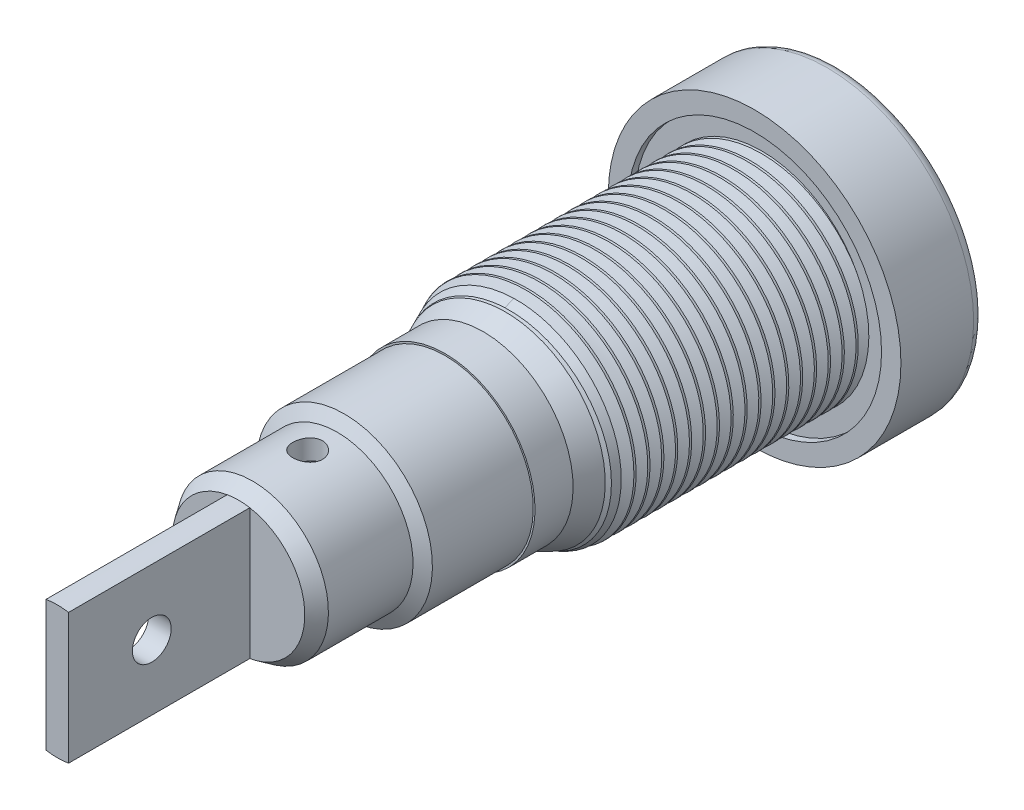
from build123d import *

# Parameters (mm, degrees)
CUT_EXTRUDE1_DEPTH              = 6.5278
CIRPATTERN1_COUNT               = 2
SKETCH3_R                       = 4.572
SKETCH3_R_2                     = 3.8608
CUT_EXTRUDE2_DEPTH              = 0.254
THREAD1_PITCH                   = 0.5
SKETCH6_R                       = 0.6985
CUT_EXTRUDE3_DEPTH              = 2.54
F_58_0_042_DIAMETER_HOLE1_D     = 1.0668
F_58_0_042_DIAMETER_HOLE1_DEPTH = 3.9878
F_58_0_042_DIAMETER_HOLE1_TIP   = 0.320499054
SKETCH8_R                       = 2.4765
CUT_EXTRUDE4_DEPTH              = 3.175
F_21_0_159_DIAMETER_HOLE1_D     = 4.0386
F_21_0_159_DIAMETER_HOLE1_DEPTH = 16.0528
F_21_0_159_DIAMETER_HOLE1_TIP   = 1.213317848
CHAMFER1_SIZE                   = 0.254
FILLET1_R                       = 0.381
CHAMFER2_SIZE                   = 0.254


with BuildPart() as part:
    # Sketch1 → Revolve1 (revolve)
    with BuildSketch(Plane(origin=(0, 0, 0), x_dir=(0, 0, -1), z_dir=(1, 0, 0))):
        Polygon((0, 0), (0, 5.2705), (-2.99974, 5.2705), (-2.99974, 3.8608), (-11.3792, 3.8608), (-12.7762, 3.2385), (-14.1478, 3.2385), (-14.1478, 3.175), (-17.78, 3.175), (-18.034, 2.7305), (-21.082, 2.7305), (-21.59, 2.3876), (-28.1178, 2.3876), (-28.1178, 0), align=None)
    revolve(axis=Axis((0, 0, 0), (0, 0, 1)))

    # Sketch2 → Cut-Extrude1 (cut)
    with BuildSketch(Plane.XY.offset(28.1178)):
        with BuildLine():
            Line((0.4064, 2.352758551), (0.4064, -2.352758551))
            ThreePointArc((0.4064, -2.352758551), (2.3876, 0), (0.4064, 2.352758551))
        make_face()
    cut_extrude1 = extrude(amount=-CUT_EXTRUDE1_DEPTH, mode=Mode.SUBTRACT)

    # CirPattern1: Cut-Extrude1 ×2 about axis
    cirpattern1_axis = Axis((0, 0, 21.082), (0, 0, -1))
    for i in range(1, CIRPATTERN1_COUNT):
        add(cut_extrude1.rotate(cirpattern1_axis, i * 360 / CIRPATTERN1_COUNT), mode=Mode.SUBTRACT)

    # Sketch3 → Cut-Extrude2 (cut)
    with BuildSketch(Plane.XY.offset(2.99974)):
        Circle(SKETCH3_R)
        with Locations(Location((0, 0, 0), (0, 0, 90))):
            Circle(SKETCH3_R_2, mode=Mode.SUBTRACT)
    extrude(amount=-CUT_EXTRUDE2_DEPTH, mode=Mode.SUBTRACT)

    # Thread1: the profile of Thread Profile1 profile screwed along a right-hand helix of 18.9992 turns, 6 arcs to a turn; built about Z, then put on its axis
    thread1_z = Axis((0, 0, 0), (0, 0, 1))
    thread1_corners = [(3.8611, 0, -0.000173205), (3.8611, 0, 0.420484201), (3.4968, 0, 0.210155498)]
    with BuildLine(mode=Mode.PRIVATE) as thread1_profile:
        Line(thread1_corners[0], thread1_corners[1])
        Line(thread1_corners[1], thread1_corners[2])
        Line(thread1_corners[2], thread1_corners[0])
    thread1_cap = Face(thread1_profile.wire())
    thread1_turn_angles = [0, 30, 60, 90, 120, 150, 180, 210, 240, 270, 300, 330, 360]
    thread1_turn_weights = [1, 0.8660254037844387, 1, 0.8660254037844387, 1, 0.8660254037844387, 1, 0.8660254037844387, 1, 0.8660254037844387, 1, 0.8660254037844387, 1]
    thread1_turn_rails = [Edge.make_bspline([Vector(p[0], p[1], 0).rotate(thread1_z, thread1_turn_angles[k]) / thread1_turn_weights[k] + Vector(0, 0, p[2] + THREAD1_PITCH * thread1_turn_angles[k] / 360) for k in range(13)], [0, 0, 0, 1, 1, 2, 2, 3, 3, 4, 4, 5, 5, 6, 6, 6], 2, thread1_turn_weights) for p in thread1_corners]
    thread1_turn_sides = [Face.make_surface_from_curves(thread1_turn_rails[p[0]], thread1_turn_rails[p[1]]) for p in [(0, 1), (1, 2), (2, 0)]]
    thread1_last_angles = [6480, 6510, 6540, 6570, 6600, 6630, 6660, 6690, 6720, 6750, 6780, 6809.856, 6839.712]
    thread1_last_weights = [1, 0.8660254037844387, 1, 0.8660254037844387, 1, 0.8660254037844387, 1, 0.8660254037844387, 1, 0.8660254037844387, 1, 0.8672793043793746, 1]
    thread1_last_rails = [Edge.make_bspline([Vector(p[0], p[1], 0).rotate(thread1_z, thread1_last_angles[k]) / thread1_last_weights[k] + Vector(0, 0, p[2] + THREAD1_PITCH * thread1_last_angles[k] / 360) for k in range(13)], [0, 0, 0, 1, 1, 2, 2, 3, 3, 4, 4, 5, 5, 6, 6, 6], 2, thread1_last_weights) for p in thread1_corners]
    thread1_last_sides = [Face.make_surface_from_curves(thread1_last_rails[p[0]], thread1_last_rails[p[1]]) for p in [(0, 1), (1, 2), (2, 0)]]
    thread1 = Plane(origin=(0, 0, 12.3792), x_dir=(-1, 0, 0), z_dir=(0, 0, -1)) * Solid(Shell([*[p.moved(Location((0, 0, THREAD1_PITCH * i))) for i in range(18) for p in thread1_turn_sides], *thread1_last_sides, thread1_cap, thread1_cap.rotate(thread1_z, 6839.712).moved(Location((0, 0, THREAD1_PITCH * 6839.712 / 360)))]))
    add(thread1, mode=Mode.SUBTRACT)

    # Sketch6 → Cut-Extrude3 (cut)
    with BuildSketch(Plane.ZY.offset(0.4064)):
        with Locations((25.1206, 0)):
            Circle(SKETCH6_R)
    extrude(amount=-CUT_EXTRUDE3_DEPTH, mode=Mode.SUBTRACT)

    # #58 (0.042) Diameter Hole1
    with Locations(Plane(origin=(0, 2.7305, 19.1008), x_dir=(0, 0, 1), z_dir=(0, 1, 0))):
        with Locations((0, 0)):
            Hole(F_58_0_042_DIAMETER_HOLE1_D / 2, depth=F_58_0_042_DIAMETER_HOLE1_DEPTH)
            with Locations((0, 0, -(F_58_0_042_DIAMETER_HOLE1_DEPTH + F_58_0_042_DIAMETER_HOLE1_TIP / 2))):  # 118° drill point
                Cone(0, F_58_0_042_DIAMETER_HOLE1_D / 2, F_58_0_042_DIAMETER_HOLE1_TIP, mode=Mode.SUBTRACT)

    # Sketch8 → Cut-Extrude4 (cut)
    with BuildSketch(Plane(origin=(0, 0, 0), x_dir=(-1, 0, 0), z_dir=(0, 0, -1))):
        with Locations(Location((0, 0, 0), (0, 0, 90))):
            Circle(SKETCH8_R)
    extrude(amount=-CUT_EXTRUDE4_DEPTH, mode=Mode.SUBTRACT)

    # #21 (0.159) Diameter Hole1
    with Locations(Plane(origin=(0, 0, 3.175), x_dir=(-1, 0, 0), z_dir=(0, 0, -1))):
        with Locations((0, 0)):
            Hole(F_21_0_159_DIAMETER_HOLE1_D / 2, depth=F_21_0_159_DIAMETER_HOLE1_DEPTH)
            with Locations((0, 0, -(F_21_0_159_DIAMETER_HOLE1_DEPTH + F_21_0_159_DIAMETER_HOLE1_TIP / 2))):  # 118° drill point
                Cone(0, F_21_0_159_DIAMETER_HOLE1_D / 2, F_21_0_159_DIAMETER_HOLE1_TIP, mode=Mode.SUBTRACT)

    # Chamfer1
    chamfer1_edges = [part.edges().sort_by_distance(p)[0] for p in [
        (-2.0193, 0, 3.175),
    ]]
    chamfer(chamfer1_edges, length=CHAMFER1_SIZE)

    # Fillet1
    fillet1_edges = [part.edges().sort_by_distance(p)[0] for p in [
        (0, -5.2705, 0),
    ]]
    fillet(fillet1_edges, radius=FILLET1_R)

    # Chamfer2
    chamfer2_edges = [part.edges().sort_by_distance(p)[0] for p in [
        (0, -2.4765, 0),
    ]]
    chamfer(chamfer2_edges, length=CHAMFER2_SIZE)


solid = part.part
